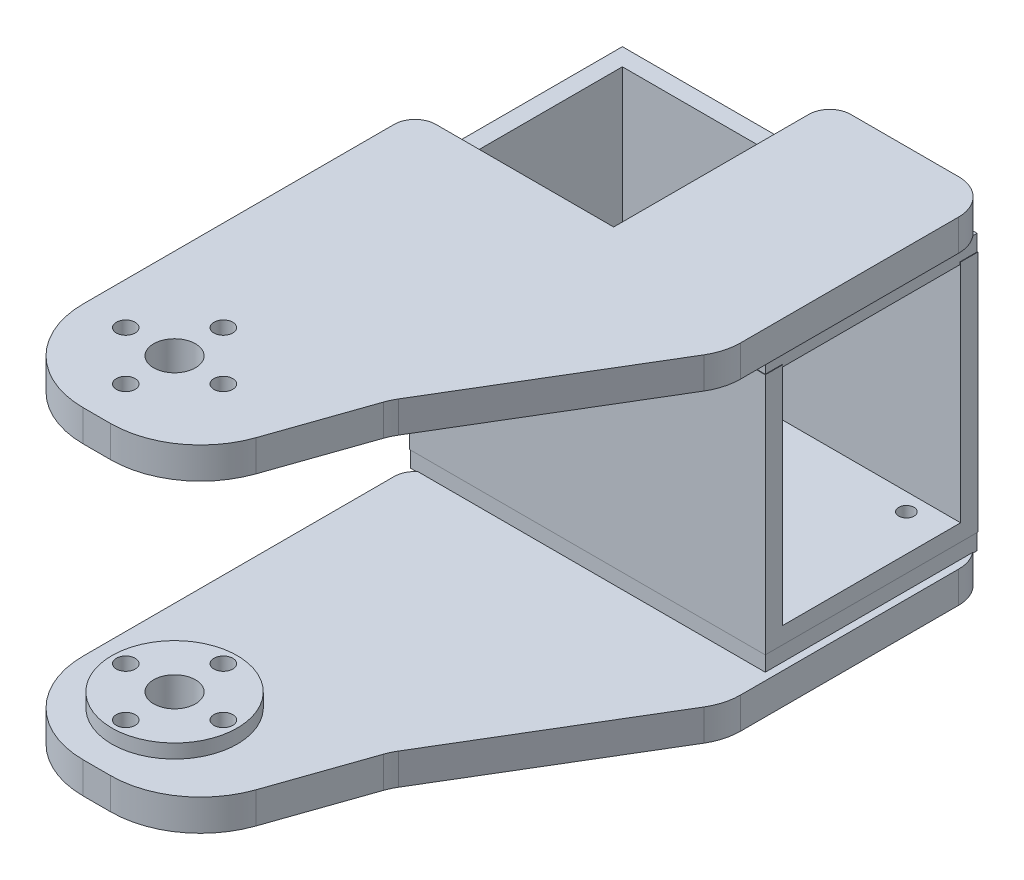
from build123d import *

# Parameters (mm, degrees)
BOSS_1_DEPTH  = 4.5
S_CYL2_R      = 9
BOSS_2_DEPTH  = 2
BOSS_3_DEPTH  = 4.5
S_BOX4_W      = 2.5
S_BOX4_H      = 34.8
BOSS_4_DEPTH  = 30.52
S_BOX5_W      = 51.02
S_BOX5_H      = 34.8
BOSS_5_DEPTH  = 2.5
S_BOX6_W      = 51.02
S_BOX6_H      = 34.8
BOSS_6_DEPTH  = 2.5
S_BOX7_W      = 51.02
S_BOX7_H      = 2.4
BOSS_7_DEPTH  = 30.52
S_BOX8_W      = 22.44
S_BOX8_H      = 2.675
BOSS_8_DEPTH  = 30.38
S_BOX9_W      = 28.47
S_BOX9_H      = 2.675
BOSS_9_DEPTH  = 1.69
S_BOX10_W     = 22.44
S_BOX10_H     = 2.425
BOSS_10_DEPTH = 30.38
S_BOX11_W     = 28.47
S_BOX11_H     = 2.425
BOSS_11_DEPTH = 1.69
S_HOLE12_R    = 3
HOLE_12_DEPTH = 4.7
S_HOLE13_R    = 1.35
HOLE_13_DEPTH = 4.7
S_HOLE14_R    = 1.35
HOLE_14_DEPTH = 4.7
S_HOLE15_R    = 1.35
HOLE_15_DEPTH = 4.7
S_HOLE16_R    = 1.35
HOLE_16_DEPTH = 4.7
S_HOLE17_R    = 3
HOLE_17_DEPTH = 6.7
S_HOLE18_R    = 1.35
HOLE_18_DEPTH = 6.7
S_HOLE19_R    = 1.35
HOLE_19_DEPTH = 6.7
S_HOLE20_R    = 1.35
HOLE_20_DEPTH = 6.7
S_HOLE21_R    = 1.35
HOLE_21_DEPTH = 6.7
S_HOLE22_R    = 11
HOLE_22_DEPTH = 2.6
S_HOLE23_R    = 1.1
HOLE_23_DEPTH = 2.6
S_HOLE24_R    = 1.1
HOLE_24_DEPTH = 2.6
S_HOLE25_R    = 1.1
HOLE_25_DEPTH = 2.6
S_HOLE26_R    = 2.5
HOLE_26_DEPTH = 6.775
S_HOLE27_R    = 2.5
HOLE_27_DEPTH = 6.775


with BuildPart() as part:
    # S_prism1 → Boss_1 (new body)
    with BuildSketch(Plane(origin=(0, 18.625, 0), x_dir=(1, 0, 0), z_dir=(0, 1, 0))):
        with BuildLine():
            Line((-0.1, -13), (3.8289, -13))
            ThreePointArc((3.8289, -13), (11.303548347, -10.613765629), (16.0129, -4.3379))
            Line((16.0129, -4.3379), (20.7288, 9.2202))
            ThreePointArc((20.7288, 9.2202), (21.038506496, 9.982013886), (21.4248, 10.708))
            Line((21.4248, 10.708), (37.8599, 38.0999))
            ThreePointArc((37.8599, 38.0999), (38.709702939, 40.080410611), (39, 42.2159))
            Line((39, 42.2159), (39, 73.5))
            ThreePointArc((39, 73.5), (37.5355, 77.0355), (34, 78.5))
            Line((34, 78.5), (18.5, 78.5))
            ThreePointArc((18.5, 78.5), (16.3787, 77.6213), (15.5, 75.5))
            Line((15.5, 75.5), (15.5, 47.5))
            Line((15.5, 47.5), (-10, 47.5))
            ThreePointArc((-10, 47.5), (-12.1213, 46.6213), (-13, 44.5))
            Line((-13, 44.5), (-13, -0.1))
            ThreePointArc((-13, -0.1), (-9.2217, -9.2217), (-0.1, -13))
        make_face()
    extrude(amount=BOSS_1_DEPTH)



with BuildPart() as body_2:
    # S_cyl2 → Boss_2 (new body)
    with BuildSketch(Plane(origin=(0, -20.625, 0), x_dir=(1, 0, 0), z_dir=(0, 1, 0))):
        Circle(S_CYL2_R)
    extrude(amount=BOSS_2_DEPTH)

    # S_prism3 → Boss_3 (add)
    with BuildSketch(Plane(origin=(0, -25.125, 0), x_dir=(1, 0, 0), z_dir=(0, 1, 0))):
        with BuildLine():
            Line((-0.1, -13), (3.8289, -13))
            ThreePointArc((3.8289, -13), (11.303548347, -10.613765629), (16.0129, -4.3379))
            Line((16.0129, -4.3379), (20.7288, 9.2202))
            ThreePointArc((20.7288, 9.2202), (21.038506496, 9.982013886), (21.4248, 10.708))
            Line((21.4248, 10.708), (37.8599, 38.0999))
            ThreePointArc((37.8599, 38.0999), (38.709702939, 40.080410611), (39, 42.2159))
            Line((39, 42.2159), (39, 73.5))
            ThreePointArc((39, 73.5), (37.5355, 77.0355), (34, 78.5))
            Line((34, 78.5), (18.5, 78.5))
            ThreePointArc((18.5, 78.5), (16.3787, 77.6213), (15.5, 75.5))
            Line((15.5, 75.5), (15.5, 47.5))
            Line((15.5, 47.5), (-10, 47.5))
            ThreePointArc((-10, 47.5), (-12.1213, 46.6213), (-13, 44.5))
            Line((-13, 44.5), (-13, -0.1))
            ThreePointArc((-13, -0.1), (-9.2217, -9.2217), (-0.1, -13))
        make_face()
    extrude(amount=BOSS_3_DEPTH)


with BuildPart() as body_3:
    # S_box4 → Boss_4 (new body)
    with BuildSketch(Plane.XY.offset(-77.26)):
        with Locations((-11.76, -1)):
            Rectangle(S_BOX4_W, S_BOX4_H)
    extrude(amount=BOSS_4_DEPTH)

    # S_box5 → Boss_5 (add)
    with BuildSketch(Plane.XY.offset(-77.26)):
        with Locations((12.5, -1)):
            Rectangle(S_BOX5_W, S_BOX5_H)
    extrude(amount=BOSS_5_DEPTH)

    # S_box6 → Boss_6 (add)
    with BuildSketch(Plane.XY.offset(-49.24)):
        with Locations((12.5, -1)):
            Rectangle(S_BOX6_W, S_BOX6_H)
    extrude(amount=BOSS_6_DEPTH)

    # S_box7 → Boss_7 (add)
    with BuildSketch(Plane.XY.offset(-77.26)):
        with Locations((12.5, -17.2)):
            Rectangle(S_BOX7_W, S_BOX7_H)
    extrude(amount=BOSS_7_DEPTH)


with BuildPart() as part_1:
    add(part.part)

    add(body_3.part)  # Boss_8 merges body 3
    # S_box8 → Boss_8 (add)
    with BuildSketch(Plane.XY.offset(-77.19)):
        with Locations((26.72, 17.3875)):
            Rectangle(S_BOX8_W, S_BOX8_H)
    extrude(amount=BOSS_8_DEPTH)

    # S_box9 → Boss_9 (add)
    with BuildSketch(Plane.XY.offset(-48.5)):
        with Locations((1.295, 17.3875)):
            Rectangle(S_BOX9_W, S_BOX9_H)
    extrude(amount=BOSS_9_DEPTH)


    add(body_2.part)  # Boss_10 merges body 2
    # S_box10 → Boss_10 (add)
    with BuildSketch(Plane.XY.offset(-77.19)):
        with Locations((26.72, -19.5125)):
            Rectangle(S_BOX10_W, S_BOX10_H)
    extrude(amount=BOSS_10_DEPTH)

    # S_box11 → Boss_11 (add)
    with BuildSketch(Plane.XY.offset(-48.5)):
        with Locations((1.295, -19.5125)):
            Rectangle(S_BOX11_W, S_BOX11_H)
    extrude(amount=BOSS_11_DEPTH)

    # S_hole12 → Hole_12 (cut)
    with BuildSketch(Plane(origin=(0, 18.525, 0), x_dir=(1, 0, 0), z_dir=(0, 1, 0))):
        Circle(S_HOLE12_R)
    extrude(amount=HOLE_12_DEPTH, mode=Mode.SUBTRACT)

    # S_hole13 → Hole_13 (cut)
    with BuildSketch(Plane(origin=(0, 18.525, 0), x_dir=(1, 0, 0), z_dir=(0, 1, 0))):
        with Locations((7, 0)):
            Circle(S_HOLE13_R)
    extrude(amount=HOLE_13_DEPTH, mode=Mode.SUBTRACT)

    # S_hole14 → Hole_14 (cut)
    with BuildSketch(Plane(origin=(0, 18.525, 0), x_dir=(1, 0, 0), z_dir=(0, 1, 0))):
        with Locations((0, -7)):
            Circle(S_HOLE14_R)
    extrude(amount=HOLE_14_DEPTH, mode=Mode.SUBTRACT)

    # S_hole15 → Hole_15 (cut)
    with BuildSketch(Plane(origin=(0, 18.525, 0), x_dir=(1, 0, 0), z_dir=(0, 1, 0))):
        with Locations((-7, 0)):
            Circle(S_HOLE15_R)
    extrude(amount=HOLE_15_DEPTH, mode=Mode.SUBTRACT)

    # S_hole16 → Hole_16 (cut)
    with BuildSketch(Plane(origin=(0, 18.525, 0), x_dir=(1, 0, 0), z_dir=(0, 1, 0))):
        with Locations((0, 7)):
            Circle(S_HOLE16_R)
    extrude(amount=HOLE_16_DEPTH, mode=Mode.SUBTRACT)

    # S_hole17 → Hole_17 (cut)
    with BuildSketch(Plane(origin=(0, -25.225, 0), x_dir=(1, 0, 0), z_dir=(0, 1, 0))):
        Circle(S_HOLE17_R)
    extrude(amount=HOLE_17_DEPTH, mode=Mode.SUBTRACT)

    # S_hole18 → Hole_18 (cut)
    with BuildSketch(Plane(origin=(0, -25.225, 0), x_dir=(1, 0, 0), z_dir=(0, 1, 0))):
        with Locations((7, 0)):
            Circle(S_HOLE18_R)
    extrude(amount=HOLE_18_DEPTH, mode=Mode.SUBTRACT)

    # S_hole19 → Hole_19 (cut)
    with BuildSketch(Plane(origin=(0, -25.225, 0), x_dir=(1, 0, 0), z_dir=(0, 1, 0))):
        with Locations((0, -7)):
            Circle(S_HOLE19_R)
    extrude(amount=HOLE_19_DEPTH, mode=Mode.SUBTRACT)

    # S_hole20 → Hole_20 (cut)
    with BuildSketch(Plane(origin=(0, -25.225, 0), x_dir=(1, 0, 0), z_dir=(0, 1, 0))):
        with Locations((-7, 0)):
            Circle(S_HOLE20_R)
    extrude(amount=HOLE_20_DEPTH, mode=Mode.SUBTRACT)

    # S_hole21 → Hole_21 (cut)
    with BuildSketch(Plane(origin=(0, -25.225, 0), x_dir=(1, 0, 0), z_dir=(0, 1, 0))):
        with Locations((0, 7)):
            Circle(S_HOLE21_R)
    extrude(amount=HOLE_21_DEPTH, mode=Mode.SUBTRACT)

    # S_hole22 → Hole_22 (cut)
    with BuildSketch(Plane(origin=(0, -18.5, 0), x_dir=(1, 0, 0), z_dir=(0, 1, 0))):
        with Locations((0, 62)):
            Circle(S_HOLE22_R)
    extrude(amount=HOLE_22_DEPTH, mode=Mode.SUBTRACT)

    # S_hole23 → Hole_23 (cut)
    with BuildSketch(Plane(origin=(0, -18.5, 0), x_dir=(1, 0, 0), z_dir=(0, 1, 0))):
        with Locations((8.3, 51.75)):
            Circle(S_HOLE23_R)
    extrude(amount=HOLE_23_DEPTH, mode=Mode.SUBTRACT)

    # S_hole24 → Hole_24 (cut)
    with BuildSketch(Plane(origin=(0, -18.5, 0), x_dir=(1, 0, 0), z_dir=(0, 1, 0))):
        with Locations((32.75, 72.25)):
            Circle(S_HOLE24_R)
    extrude(amount=HOLE_24_DEPTH, mode=Mode.SUBTRACT)

    # S_hole25 → Hole_25 (cut)
    with BuildSketch(Plane(origin=(0, -18.5, 0), x_dir=(1, 0, 0), z_dir=(0, 1, 0))):
        with Locations((32.75, 51.75)):
            Circle(S_HOLE25_R)
    extrude(amount=HOLE_25_DEPTH, mode=Mode.SUBTRACT)

    # S_hole26 → Hole_26 (cut)
    with BuildSketch(Plane(origin=(0, -25.225, 0), x_dir=(1, 0, 0), z_dir=(0, 1, 0))):
        with Locations((32.75, 72.25)):
            Circle(S_HOLE26_R)
    extrude(amount=HOLE_26_DEPTH, mode=Mode.SUBTRACT)

    # S_hole27 → Hole_27 (cut)
    with BuildSketch(Plane(origin=(0, -25.225, 0), x_dir=(1, 0, 0), z_dir=(0, 1, 0))):
        with Locations((32.75, 51.75)):
            Circle(S_HOLE27_R)
    extrude(amount=HOLE_27_DEPTH, mode=Mode.SUBTRACT)


solid = part_1.part
